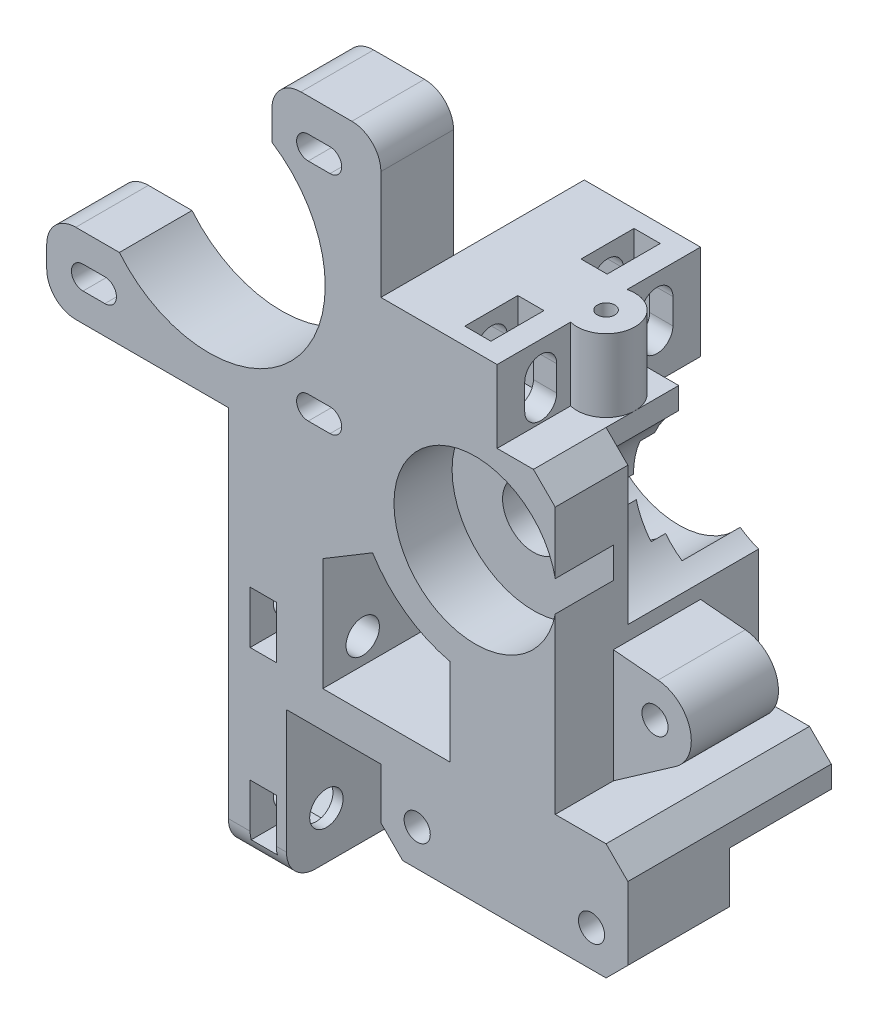
from build123d import *

# Parameters (mm, degrees)
SKETCH1_R                = 1.8
SKETCH1_R_2              = 4.25
SKETCH1_R_3              = 5
BOSS_EXTRUDE1_DEPTH      = 34
SKETCH7_R                = 11.2
SKETCH7_W                = 10.733214283
SKETCH7_H                = 15.639003246
CUT_EXTRUDE5_DEPTH       = 8
SKETCH2_R                = 2.3
CUT_EXTRUDE1_DEPTH       = 28
SKETCH4_W                = 10
SKETCH4_H                = 10
CUT_EXTRUDE2_DEPTH       = 24
CUT_EXTRUDE3_DEPTH       = 6
SKETCH6_R                = 11
SKETCH6_W                = 10.733214283
SKETCH6_H                = 15.639003246
CUT_EXTRUDE4_DEPTH       = 14
SKETCH8_W                = 34
SKETCH8_H                = 10
CUT_EXTRUDE7_DEPTH       = 14
SKETCH9_R                = 7.9
CUT_EXTRUDE8_DEPTH       = 2
SKETCH10_W               = 3.6
SKETCH10_H               = 7.3
CUT_EXTRUDE9_DEPTH       = 10
CUT_EXTRUDE10_DEPTH      = 129.139614759
CUT_EXTRUDE10_DEPTH_BACK = 129.139614759
SKETCH11_R               = 1.2
CUT_EXTRUDE11_START      = -6
SKETCH12_R               = 8.1
CUT_EXTRUDE11_DEPTH      = 4
SKETCH13_R               = 6.1
CUT_EXTRUDE12_DEPTH      = 6
CUT_EXTRUDE14_REACH      = 97.373
CUT_EXTRUDE15_DEPTH      = 3.6
FILLET1_R                = 4
FAIL_DEPTH               = 114.013273557
FAIL_DEPTH_BACK          = 114.013273557
SKETCH17_W               = 10
SKETCH17_H               = 10
CHAMFER1_SIZE            = 3


with BuildPart() as part:
    # Sketch1 → Boss-Extrude1 (new body)
    # profile 1 of 2: a face of its own
    with BuildSketch(Plane.XY):
        with BuildLine():
            Line((10, 0), (0, 0))
            Line((0, 0), (0, -11))
            Line((0, -11), (25, -11))
            Line((25, -11), (25, -64))
            Line((25, -64), (33, -64))
            Line((33, -64), (33, -43))
            Line((33, -43), (46, -43))
            Line((46, -43), (46, -53))
            Line((46, -53), (85, -53))
            ThreePointArc((85, -53), (90, -48), (85, -43))
            Line((85, -43), (80, -43))
            Line((80, -43), (80, -37))
            Line((80, -37), (70, -37))
            Line((70, -37), (78.601096465, -30.977447418))
            ThreePointArc((78.601096465, -30.977447418), (70.903585152, -28.175782422), (76.168992997, -21.900713706))
            Line((76.168992997, -21.900713706), (70, -21.360996754))
            Line((70, -21.360996754), (70, 12.639003246))
            Line((70, 12.639003246), (46, 12.639003246))
            Line((46, 12.639003246), (46, 31.639003246))
            Line((46, 31.639003246), (31, 31.639003246))
            Line((31, 31.639003246), (31, 23.639003246))
            ThreePointArc((31, 23.639003246), (34.300446676, -0.440295339), (10, 0))
        make_face()
        with Locations((51, -48)):
            Circle(SKETCH1_R, mode=Mode.SUBTRACT)
        with Locations((75, -48)):
            Circle(SKETCH1_R, mode=Mode.SUBTRACT)
        with Locations((85, -48)):
            Circle(SKETCH1_R, mode=Mode.SUBTRACT)
        with BuildLine():
            Line((38, -38), (38, -22.5))
            Line((38, -22.5), (44.857338406, -18.379695401))
            ThreePointArc((44.857338406, -18.379695401), (49.415844006, -23.255223804), (55.5, -26))
            Line((55.5, -26), (55.5, -38))
            Line((55.5, -38), (38, -38))
        make_face(mode=Mode.SUBTRACT)
        with BuildLine():
            ThreePointArc((5, -7.1), (3.4, -5.5), (5, -3.9))
            Line((5, -3.9), (8, -3.9))
            ThreePointArc((8, -3.9), (9.6, -5.5), (8, -7.1))
            Line((8, -7.1), (5, -7.1))
        make_face(mode=Mode.SUBTRACT)
        with BuildLine():
            ThreePointArc((36, -7.1), (34.4, -5.5), (36, -3.9))
            Line((36, -3.9), (39, -3.9))
            ThreePointArc((39, -3.9), (40.6, -5.5), (39, -7.1))
            Line((39, -7.1), (36, -7.1))
        make_face(mode=Mode.SUBTRACT)
        with BuildLine():
            ThreePointArc((36, 23.9), (34.4, 25.5), (36, 27.1))
            Line((36, 27.1), (39, 27.1))
            ThreePointArc((39, 27.1), (40.6, 25.5), (39, 23.9))
            Line((39, 23.9), (36, 23.9))
        make_face(mode=Mode.SUBTRACT)
        with Locations((59, -11)):
            Circle(SKETCH1_R_2, mode=Mode.SUBTRACT)
    # profile 2 of 2: a face of its own
    with BuildSketch(Plane.XY):
        with Locations((75.733214283, -26.881687197)):
            Circle(SKETCH1_R_3)
        with Locations((75.733214283, -26.881687197)):
            Circle(SKETCH1_R, mode=Mode.SUBTRACT)
    extrude(amount=-BOSS_EXTRUDE1_DEPTH)

    # Sketch7 → Cut-Extrude5 (cut)
    with BuildSketch(Plane.XY):
        with Locations((59, -11)):
            Circle(SKETCH7_R)
        with Locations((75.366607141, -29.180498377)):
            Rectangle(SKETCH7_W, SKETCH7_H)
    extrude(amount=-CUT_EXTRUDE5_DEPTH, mode=Mode.SUBTRACT)

    # Sketch2 → Cut-Extrude1 (cut)
    with BuildSketch(Plane.ZY.offset(-25)):
        with Locations((-28.5, -34.5)):
            Circle(SKETCH2_R)
        with Locations((-5.5, -34.5)):
            Circle(SKETCH2_R)
        with Locations((-5.5, -57.5)):
            Circle(SKETCH2_R)
        with Locations((-28.5, -57.5)):
            Circle(SKETCH2_R)
        Polygon((-34, -24), (-28, -24), (-28, 13.5), (-10, 13.5), (-10, 31.639003246), (-34, 31.639003246), align=None)
    extrude(amount=-CUT_EXTRUDE1_DEPTH, mode=Mode.SUBTRACT)

    # Sketch4 → Cut-Extrude2 (cut)
    with BuildSketch(Plane(origin=(0, 0, -34), x_dir=(-1, 0, 0), z_dir=(0, 0, -1))):
        Polygon((-25, -24), (-46, -11.380570536), (-46, 31.639003246), (0, 31.639003246), (0, -11), (-25, -11), align=None)
        with BuildLine():
            Line((-70, 12.639003246), (-67, 12.639003246))
            Line((-67, 12.639003246), (-67, -0.360996754))
            ThreePointArc((-67, -0.360996754), (-62.907818619, -10.743972761), (-70, -19.360996754))
            Line((-70, -19.360996754), (-70, 12.639003246))
        make_face()
        with Locations((-85, -48)):
            Rectangle(SKETCH4_W, SKETCH4_H)
    extrude(amount=-CUT_EXTRUDE2_DEPTH, mode=Mode.SUBTRACT)

    # Sketch5 → Cut-Extrude3 (cut)
    with BuildSketch(Plane(origin=(0, 0, -34), x_dir=(-1, 0, 0), z_dir=(0, 0, -1))):
        Polygon((-33, -24), (-33, -64), (-90, -64), (-90, 31.639003246), (0, 31.639003246), (0, -24), align=None)
    extrude(amount=-CUT_EXTRUDE3_DEPTH, mode=Mode.SUBTRACT)

    # Sketch6 → Cut-Extrude4 (cut)
    with BuildSketch(Plane(origin=(0, 0, -34), x_dir=(-1, 0, 0), z_dir=(0, 0, -1))):
        with BuildLine():
            Line((-62, 12.639003246), (-67, 12.639003246))
            Line((-67, 12.639003246), (-67, -3.450165565))
            ThreePointArc((-67, -3.450165565), (-64.705263472, -1.595215648), (-62, -0.416994756))
            Line((-62, -0.416994756), (-62, 12.639003246))
        make_face()
        with Locations((-59, -11)):
            Circle(SKETCH6_R)
        with Locations((-75.366607141, -29.180498377)):
            Rectangle(SKETCH6_W, SKETCH6_H)
    extrude(amount=-CUT_EXTRUDE4_DEPTH, mode=Mode.SUBTRACT)

    # Sketch8 → Cut-Extrude7 (cut)
    with BuildSketch(Plane(origin=(0, 0, -28), x_dir=(-1, 0, 0), z_dir=(0, 0, -1))):
        with Locations((-63, -48)):
            Rectangle(SKETCH8_W, SKETCH8_H)
    extrude(amount=-CUT_EXTRUDE7_DEPTH, mode=Mode.SUBTRACT)

    # Sketch9 → Cut-Extrude8 (cut)
    with BuildSketch(Plane(origin=(0, 0, -20), x_dir=(-1, 0, 0), z_dir=(0, 0, -1))):
        with Locations((-59, -11)):
            Circle(SKETCH9_R)
    extrude(amount=-CUT_EXTRUDE8_DEPTH, mode=Mode.SUBTRACT)

    # Sketch10 → Cut-Extrude9 (cut)
    with BuildSketch(Plane(origin=(0, 12.639003246, 0), x_dir=(1, 0, 0), z_dir=(0, 1, 0))):
        with Locations((57, 22)):
            Rectangle(SKETCH10_W, SKETCH10_H)
        with BuildLine():
            ThreePointArc((62, 17.872983346), (65.449489743, 17.16227766), (67, 14))
            Line((67, 14), (67, 20))
            Line((67, 20), (62, 20))
            Line((62, 20), (62, 17.872983346))
        make_face()
        with BuildLine():
            Line((70, 0), (70, 10))
            Line((70, 10), (67, 10))
            Line((67, 10), (67, 14))
            ThreePointArc((67, 14), (65.449489743, 10.83772234), (62, 10.127016654))
            Line((62, 10.127016654), (62, 0))
            Line((62, 0), (70, 0))
        make_face()
        with Locations((57, 6)):
            Rectangle(SKETCH10_W, SKETCH10_H)
    extrude(amount=-CUT_EXTRUDE9_DEPTH, mode=Mode.SUBTRACT)

    # Sketch11 → Cut-Extrude10 (cut, two sides: drawn at the far end of the back side and taken through both)
    with BuildSketch(Plane.XZ.offset(53).offset(-CUT_EXTRUDE10_DEPTH_BACK)):
        with Locations(Location((63, -14, 0), (0, 0, 277.376864274))):
            Circle(SKETCH11_R)
    extrude(amount=CUT_EXTRUDE10_DEPTH + CUT_EXTRUDE10_DEPTH_BACK, mode=Mode.SUBTRACT)

    # Sketch12 → Cut-Extrude11 (cut)
    with BuildSketch(Plane.XZ.offset(53).offset(CUT_EXTRUDE11_START)):
        with Locations((63, -14)):
            Circle(SKETCH12_R)
    extrude(amount=-CUT_EXTRUDE11_DEPTH, mode=Mode.SUBTRACT)

    # Sketch13 → Cut-Extrude12 (cut)
    with BuildSketch(Plane.XZ.offset(53)):
        with Locations((63, -14)):
            Circle(SKETCH13_R)
    extrude(amount=-CUT_EXTRUDE12_DEPTH, mode=Mode.SUBTRACT)

    # Cut-Extrude14: up to this face of the body (flat: up to its plane)
    cut_extrude14_end = Plane(part.part.faces().sort_by_distance((46, 0.629216355, -19))[0])
    # Sketch15 → Cut-Extrude14 (cut, up to the picked face)
    with BuildSketch(Plane(origin=(62, 0, 0), x_dir=(0, 0, -1), z_dir=(1, 0, 0)), mode=Mode.PRIVATE) as cut_extrude14_sk1:
        with BuildLine():
            Line((8.2, 8.639003246), (8.2, 5.139003246))
            ThreePointArc((8.2, 5.139003246), (6, 2.939003246), (3.8, 5.139003246))
            Line((3.8, 5.139003246), (3.8, 8.639003246))
            ThreePointArc((3.8, 8.639003246), (6, 10.839003246), (8.2, 8.639003246))
        make_face()
    cut_extrude14_tool1 = split(extrude(cut_extrude14_sk1.sketch, amount=-CUT_EXTRUDE14_REACH, mode=Mode.PRIVATE), bisect_by=cut_extrude14_end, keep=Keep.BOTH, mode=Mode.PRIVATE)
    # Sketch15 → Cut-Extrude14 (cut, up to the picked face)
    with BuildSketch(Plane(origin=(62, 0, 0), x_dir=(0, 0, -1), z_dir=(1, 0, 0)), mode=Mode.PRIVATE) as cut_extrude14_sk2:
        with BuildLine():
            Line((24.2, 8.639003246), (24.2, 5.139003246))
            ThreePointArc((24.2, 5.139003246), (22, 2.939003246), (19.8, 5.139003246))
            Line((19.8, 5.139003246), (19.8, 8.639003246))
            ThreePointArc((19.8, 8.639003246), (22, 10.839003246), (24.2, 8.639003246))
        make_face()
    cut_extrude14_tool2 = split(extrude(cut_extrude14_sk2.sketch, amount=-CUT_EXTRUDE14_REACH, mode=Mode.PRIVATE), bisect_by=cut_extrude14_end, keep=Keep.BOTH, mode=Mode.PRIVATE)
    add(cut_extrude14_tool1.solids().sort_by(Axis((62, 6.889003, -6), (-1, 0, 0)))[0], mode=Mode.SUBTRACT)
    add(cut_extrude14_tool2.solids().sort_by(Axis((62, 6.889003, -22), (-1, 0, 0)))[0], mode=Mode.SUBTRACT)

    # Sketch16 → Cut-Extrude15 (cut)
    with BuildSketch(Plane.ZY.offset(-28)):
        Polygon((-34, -30.9), (-34, -38.1), (-30.578460969, -38.1), (-32.656921938, -34.5), (-30.578460969, -30.9), align=None)
        Polygon((-30.578460969, -38.1), (-26.421539031, -38.1), (-24.343078062, -34.5), (-26.421539031, -30.9), (-30.578460969, -30.9), (-32.656921938, -34.5), align=None)
        Polygon((-34, -53.9), (-34, -61.1), (-30.578460969, -61.1), (-32.656921938, -57.5), (-30.578460969, -53.9), align=None)
        Polygon((-30.578460969, -61.1), (-26.421539031, -61.1), (-24.343078062, -57.5), (-26.421539031, -53.9), (-30.578460969, -53.9), (-32.656921938, -57.5), align=None)
        Polygon((-3.421539031, -30.9), (-7.578460969, -30.9), (-9.656921938, -34.5), (-7.578460969, -38.1), (-3.421539031, -38.1), (-1.343078062, -34.5), align=None)
        Polygon((0, -38.1), (-3.421539031, -38.1), (-1.343078062, -34.5), (-3.421539031, -30.9), (0, -30.9), align=None)
        Polygon((-3.421539031, -53.9), (-7.578460969, -53.9), (-9.656921938, -57.5), (-7.578460969, -61.1), (-3.421539031, -61.1), (-1.343078062, -57.5), align=None)
        Polygon((0, -61.1), (-3.421539031, -61.1), (-1.343078062, -57.5), (-3.421539031, -53.9), (0, -53.9), align=None)
    extrude(amount=-CUT_EXTRUDE15_DEPTH, mode=Mode.SUBTRACT)

    # Fillet1
    # the kernel refuses this fillet: 4 mm, written as the material it takes off along each edge
    with BuildSketch(Plane(origin=(31, 31.639003246, 10), x_dir=(1, 0, 0), z_dir=(0, 0, -1)), Plane(origin=(46, 31.639003246, 10), x_dir=(0, -1, 0), z_dir=(0, 0, -1))) as fillet1_piece_1:
        with BuildLine():
            CenterArc((FILLET1_R, FILLET1_R), FILLET1_R, 180, 90)
            Line((0, FILLET1_R), (0, 0))
            Line((0, 0), (FILLET1_R, 0))
        make_face()
    extrude(amount=30, mode=Mode.SUBTRACT)
    with BuildSketch(Plane(origin=(0, 0, 10), x_dir=(0, -1, 0), z_dir=(0, 0, -1)), Plane(origin=(0, -11, 10), x_dir=(1, 0, 0), z_dir=(0, 0, -1))) as fillet1_piece_2:
        with BuildLine():
            CenterArc((FILLET1_R, -FILLET1_R), FILLET1_R, 90, 90)
            Line((0, -FILLET1_R), (0, 0))
            Line((0, 0), (FILLET1_R, 0))
        make_face()
    extrude(amount=30, mode=Mode.SUBTRACT)
    with BuildSketch(Plane(origin=(15, -24, -34), x_dir=(0, 0, 1), z_dir=(1, 0, 0))) as fillet1_piece_3:
        with BuildLine():
            CenterArc((FILLET1_R, FILLET1_R), FILLET1_R, 180, 90)
            Line((0, FILLET1_R), (0, 0))
            Line((0, 0), (FILLET1_R, 0))
        make_face()
    extrude(amount=28, mode=Mode.SUBTRACT)
    with BuildSketch(Plane(origin=(15, -64, -34), x_dir=(0, 0, 1), z_dir=(1, 0, 0)), Plane(origin=(15, -64, 0), x_dir=(0, 1, 0), z_dir=(1, 0, 0))) as fillet1_piece_4:
        with BuildLine():
            CenterArc((FILLET1_R, -FILLET1_R), FILLET1_R, 90, 90)
            Line((0, -FILLET1_R), (0, 0))
            Line((0, 0), (FILLET1_R, 0))
        make_face()
    extrude(amount=28, mode=Mode.SUBTRACT)

    # Sketch17 → fail (cut, two sides: drawn at the far end of the back side and taken through both)
    with BuildSketch(Plane(origin=(0, 0, -10), x_dir=(-1, 0, 0), z_dir=(0, 0, -1)).offset(-FAIL_DEPTH_BACK)):
        with Locations((-85, -48)):
            Rectangle(SKETCH17_W, SKETCH17_H)
    extrude(amount=FAIL_DEPTH + FAIL_DEPTH_BACK, mode=Mode.SUBTRACT)

    # Chamfer1
    chamfer1_edges = [part.edges().sort_by_distance(p)[0] for p in [
        (46, -53, -7),
        (80, -53, -7),
        (70, 2.639003246, -5),
        (80, -37, -14),
    ]]
    chamfer(chamfer1_edges, length=CHAMFER1_SIZE)


solid = part.part
